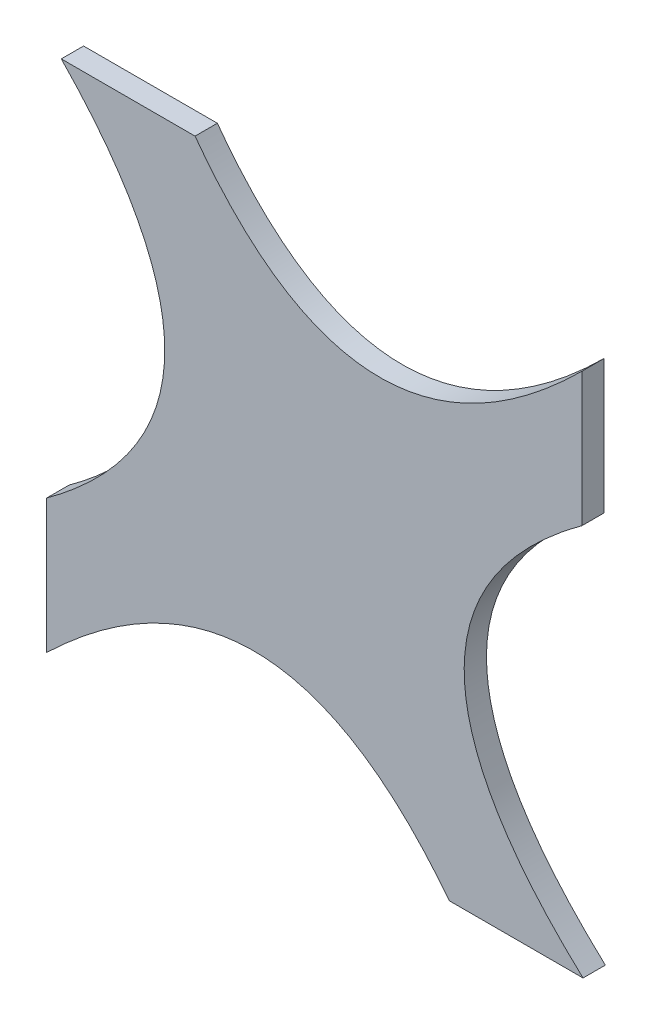
from build123d import *

# Parameters (mm, degrees)
BOSS_EXTRUDE1_DEPTH = 5


with BuildPart() as part:
    # Sketch1 → Boss-Extrude1 (new body)
    with BuildSketch(Plane.XY):
        with BuildLine():
            Line((-17.005498743, 52.5), (-47.005498743, 52.5))
            add(Edge.make_bspline(
                [(-47.005498743, 52.5), (0.980982359, 3.059169107), (-50.285, -34.424472185)],
                knots=[0, 0, 0, 1, 1, 1], degree=2))
            Line((-50.285, -34.424472185), (-50.285, -64.424472185))
            add(Edge.make_bspline(
                [(-50.285, -64.424472185), (0.251672885, -15.883610393), (40.003240311, -67.5)],
                knots=[0, 0, 0, 1, 1, 1], degree=2))
            Line((40.003240311, -67.5), (70.003240311, -67.5))
            add(Edge.make_bspline(
                [(70.003240311, -67.5), (16.839593252, -18.521167817), (69.715, 20.175927607)],
                knots=[0, 0, 0, 1, 1, 1], degree=2))
            Line((69.715, 20.175927607), (69.715, 50.175927607))
            add(Edge.make_bspline(
                [(69.715, 50.175927607), (20.536285444, 1.406864348), (-17.005498743, 52.5)],
                knots=[0, 0, 0, 1, 1, 1], degree=2))
        make_face()
    extrude(amount=BOSS_EXTRUDE1_DEPTH)


solid = part.part
